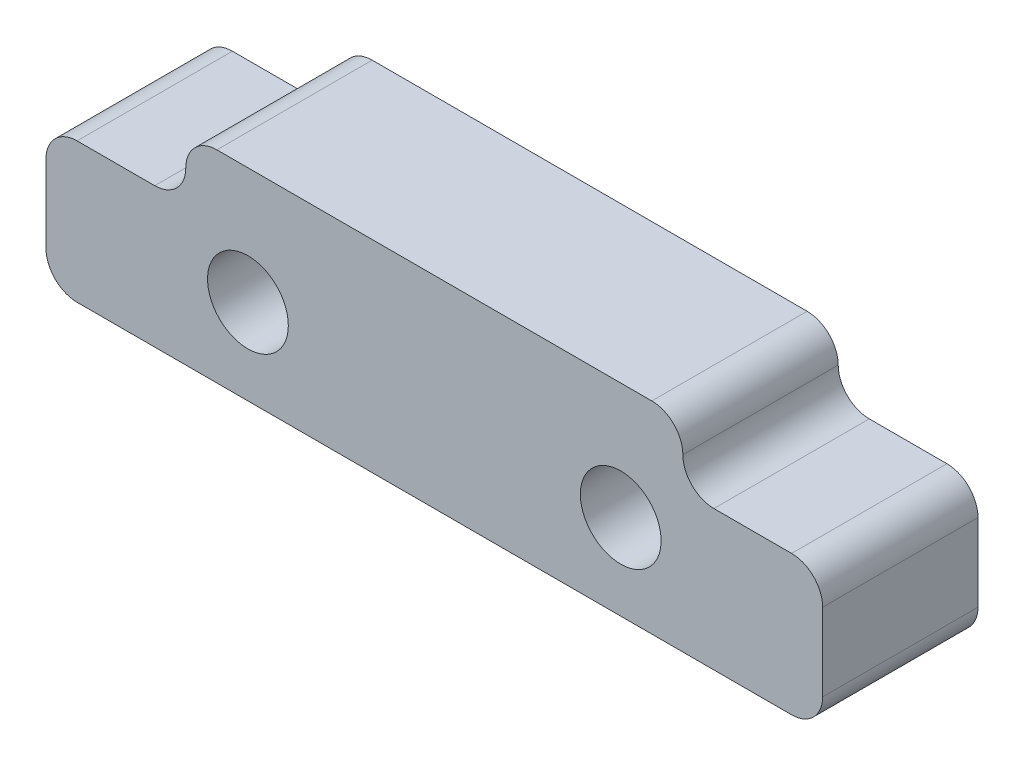
from build123d import *

# Parameters (mm, degrees)
SKETCH_1_R      = 1.3
EXTRUDE_1_DEPTH = 5
FILLET_1_R      = 1


with BuildPart() as part:
    # 草图1 → 凸台-拉伸1 (new body)
    with BuildSketch(Plane.XY):
        Polygon((12.5, -2.25), (-12.5, -2.25), (-12.5, 2.25), (-8, 2.25), (-8, 4.25), (8, 4.25), (8, 2.25), (12.5, 2.25), align=None)
        with Locations((-6, 0.5)):
            Circle(SKETCH_1_R, mode=Mode.SUBTRACT)
        with Locations(Location((6, 0.5, 0), (0, 0, 180))):
            Circle(SKETCH_1_R, mode=Mode.SUBTRACT)
    extrude(amount=EXTRUDE_1_DEPTH)

    # 圆角1
    fillet_1_edges = [part.edges().sort_by_distance(p)[0] for p in [
        (12.5, -2.25, 2.5),
        (12.5, 2.25, 2.5),
        (-12.5, -2.25, 2.5),
        (-12.5, 2.25, 2.5),
        (-8, 4.25, 2.5),
        (8, 4.25, 2.5),
        (8, 2.25, 2.5),
        (-8, 2.25, 2.5),
    ]]
    fillet(fillet_1_edges, radius=FILLET_1_R - 0.0001)  # a hair under: the kernel refuses the full size


solid = part.part
